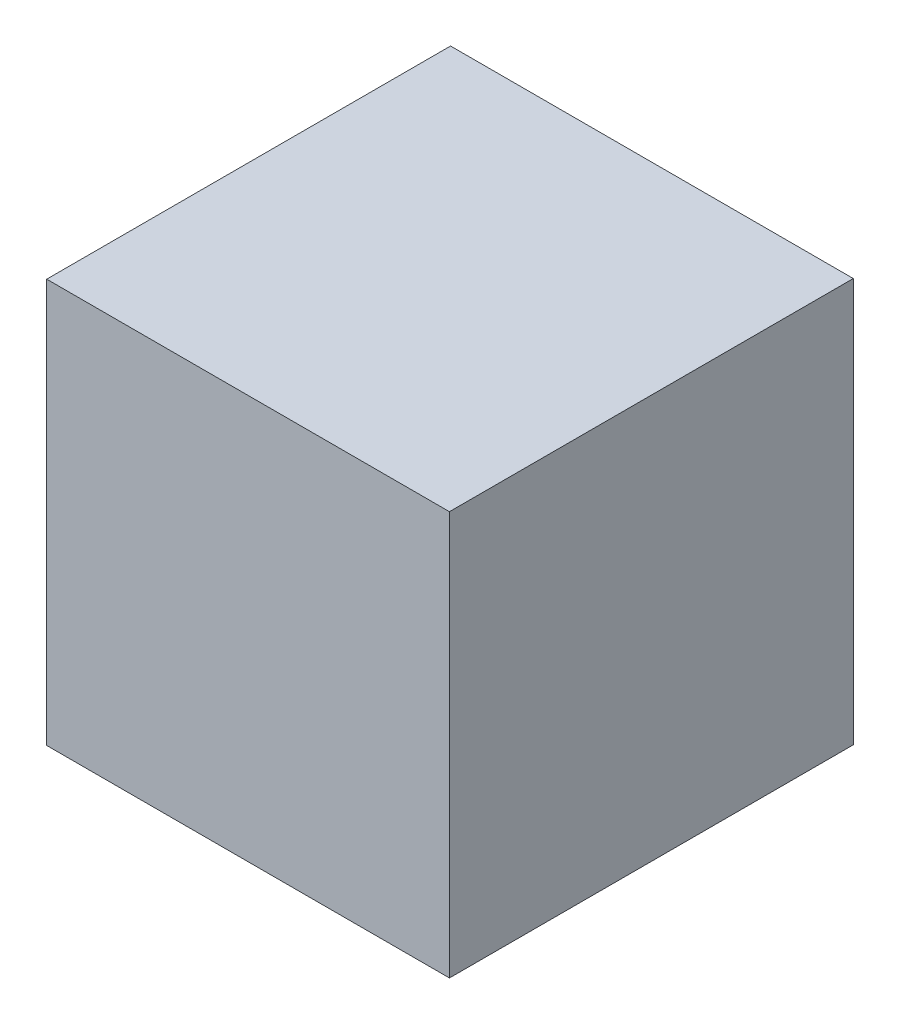
from build123d import *

# Parameters (mm, degrees)
SKETCH2_W           = 914.4
SKETCH2_H           = 914.4
BOSS_EXTRUDE1_DEPTH = 914.4
SHELL2_T            = 2.54


with BuildPart() as part:
    # Sketch2 → Boss-Extrude1 (new body)
    with BuildSketch(Plane.XY):
        with Locations((0, 457.2)):
            Rectangle(SKETCH2_W, SKETCH2_H)
    extrude(amount=BOSS_EXTRUDE1_DEPTH)

    # Shell2
    shell2_openings = [part.faces().sort_by_distance(p)[0] for p in [
        (-457.2, 457.2, 457.2),
    ]]
    offset(amount=SHELL2_T, openings=shell2_openings, kind=Kind.INTERSECTION)


solid = part.part
